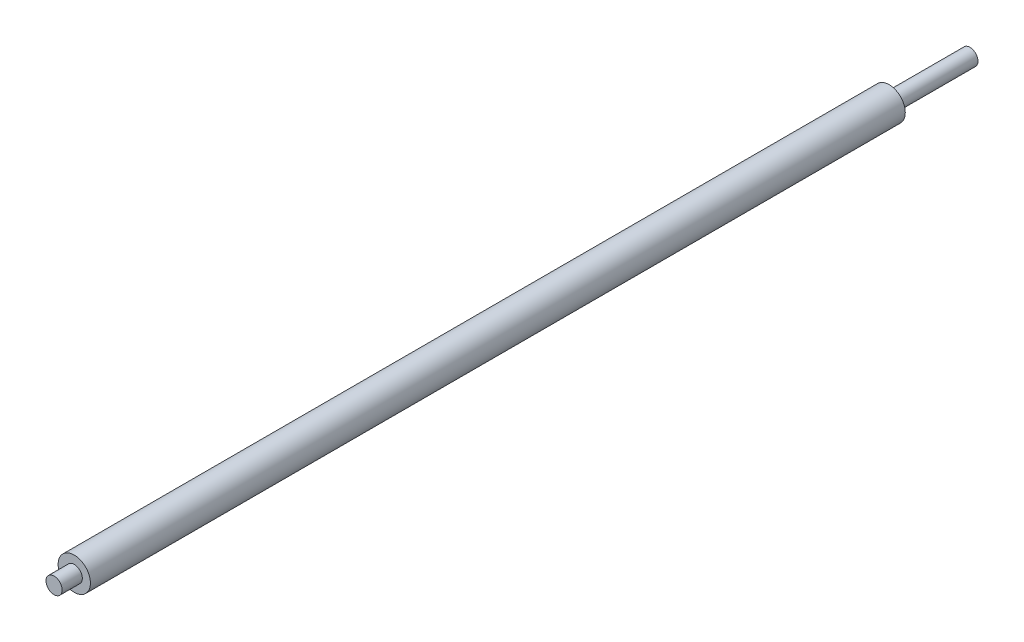
from build123d import *

# Parameters (mm, degrees)
SKETCH1_R           = 6
BOSS_EXTRUDE1_DEPTH = 151.25
SKETCH2_R           = 3
BOSS_EXTRUDE2_DEPTH = 7.5
BOSS_EXTRUDE3_START = 30
SKETCH3_R           = 3
BOSS_EXTRUDE3_DEPTH = 30


with BuildPart() as part:
    # Sketch1 → Boss-Extrude1 (new, symmetric)
    with BuildSketch(Plane.XY):
        Circle(SKETCH1_R)
    extrude(amount=BOSS_EXTRUDE1_DEPTH, both=True)

    # Sketch2 → Boss-Extrude2 (add)
    with BuildSketch(Plane.XY.offset(151.25)):
        Circle(SKETCH2_R)
    extrude(amount=BOSS_EXTRUDE2_DEPTH)

    # Sketch3 → Boss-Extrude3 (add)
    with BuildSketch(Plane(origin=(0, 0, -151.25), x_dir=(-1, 0, 0), z_dir=(0, 0, -1)).offset(BOSS_EXTRUDE3_START)):
        Circle(SKETCH3_R)
    extrude(amount=-BOSS_EXTRUDE3_DEPTH)


solid = part.part
